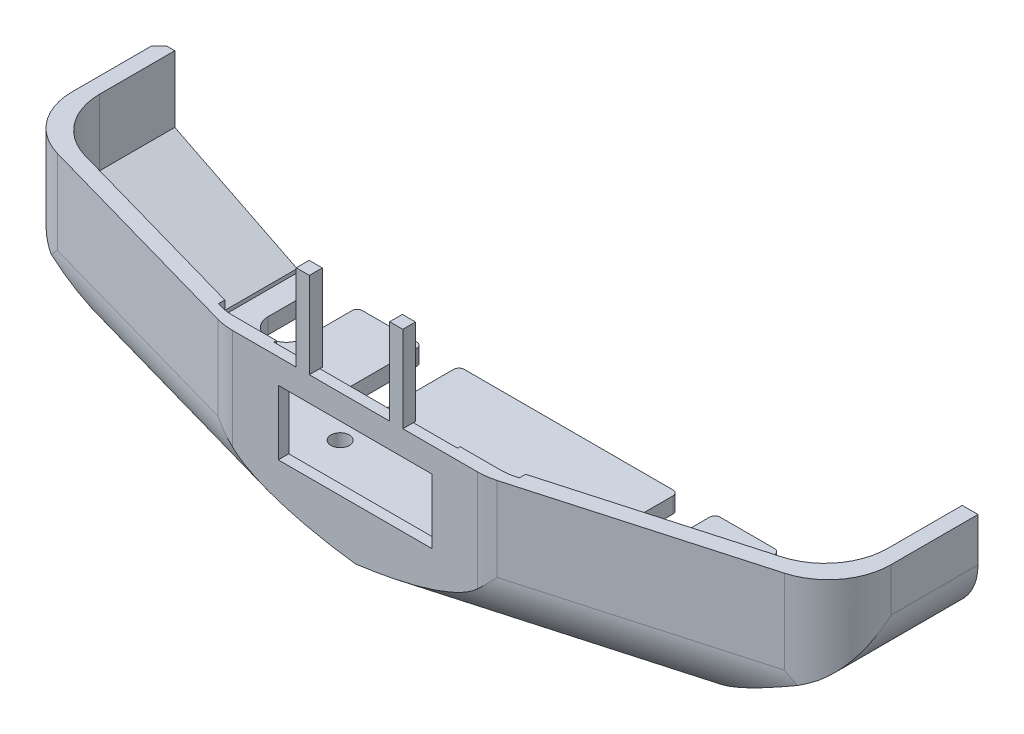
from build123d import *

# Parameters (mm, degrees)
BOSS_EXTRUDE1_DEPTH      = 30
BOSS_EXTRUDE1_DEPTH_BACK = 10.64
CUT_EXTRUDE1_DEPTH       = 89.136258146
SHELL1_T                 = -3
CUT_EXTRUDE4_DEPTH       = 4
CUT_EXTRUDE4_DEPTH_BACK  = 10
FILLET3_R                = 8
FILLET1_R                = 12
SKETCH4_R                = 1.75
CUT_EXTRUDE2_DEPTH       = 30
BOSS_EXTRUDE5_REACH      = 89.23
CUT_EXTRUDE5_DEPTH       = 4
SKETCH12_W               = 29.3
SKETCH12_H               = 12.3
CUT_EXTRUDE6_DEPTH       = 3
CUT_EXTRUDE7_DEPTH       = 22
FILLET2_START            = -12
FILLET2_DEPTH            = 29.471357663
BOSS_EXTRUDE4_REACH      = 98.884
SKETCH14_W               = 2.5
SKETCH14_H               = 16.4
SKETCH18_R               = 3.5
CUT_EXTRUDE11_DEPTH      = 10
CUT_EXTRUDE12_DEPTH      = 10
CHAMFER1_SIZE            = 1.5
FILLET5_R                = 1


with BuildPart() as part:
    # Sketch1 → Boss-Extrude1 (new, two sides: drawn at the far end of the back side and taken through both)
    with BuildSketch(Plane.XY.offset(-BOSS_EXTRUDE1_DEPTH_BACK)):
        Polygon((-51, -40.630628171), (51, -40.630628171), (78, -27.130628171), (78, -12.630628171), (-78, -12.630628171), (-78, -27.130628171), align=None)
    extrude(amount=BOSS_EXTRUDE1_DEPTH + BOSS_EXTRUDE1_DEPTH_BACK)

    # Sketch2 → Cut-Extrude1 (cut, through all)
    with BuildSketch(Plane(origin=(0, -12.630628171, 0), x_dir=(1, 0, 0), z_dir=(0, 1, 0))):
        Polygon((-78, -15), (-25, -30), (25, -30), (78, -15), (78, -44.649515781), (-78, -44.649515781), align=None)
    extrude(amount=-CUT_EXTRUDE1_DEPTH, mode=Mode.SUBTRACT)

    # Shell1
    shell1_openings = [part.faces().sort_by_distance(p)[0] for p in [
        (0, -25.765697486, -10.64),
    ]]
    offset(amount=SHELL1_T, openings=shell1_openings, kind=Kind.INTERSECTION)

    # Sketch7 → Cut-Extrude4 (cut, two sides: drawn at the far end of the back side and taken through both)
    with BuildSketch(Plane.XZ.offset(15.630628171).offset(-CUT_EXTRUDE4_DEPTH_BACK)):
        with BuildLine():
            Line((-24.583648517, 27), (24.096351483, 27))
            Line((24.096351483, 27), (66.26786959, 15.064664687))
            ThreePointArc((66.26786959, 15.064664687), (72.571165945, 10.756478016), (75, 3.518192137))
            Line((75, 3.518192137), (75, -10.64))
            Line((75, -10.64), (-75, -10.64))
            Line((-75, -10.64), (-75, 3.656106392))
            ThreePointArc((-75, 3.656106392), (-72.571165945, 10.894392271), (-66.26786959, 15.202578942))
            Line((-66.26786959, 15.202578942), (-24.583648517, 27))
        make_face()
    extrude(amount=CUT_EXTRUDE4_DEPTH + CUT_EXTRUDE4_DEPTH_BACK, mode=Mode.SUBTRACT)

    # Fillet3
    # the kernel refuses this fillet: 8 mm, written as the material it adds along each edge
    with BuildSketch(Plane(origin=(-69.535916984, -37.630628171, 14.277659868), x_dir=(0.27232246579934893, 0, -0.9622060458243663), z_dir=(0.9622060458243663, 0, 0.27232246579934893))) as fillet3_piece_1_section:
        with BuildLine():
            CenterArc((FILLET3_R, FILLET3_R), FILLET3_R, 180, 90)
            Line((0, FILLET3_R), (0, 0))
            Line((0, 0), (FILLET3_R, 0))
        make_face()
    fillet3_piece_1 = extrude(amount=80.717923528, mode=Mode.PRIVATE)
    fillet3_piece_1 = split(fillet3_piece_1, bisect_by=Plane(origin=(-65.687092801, -29.932979805, 14.277659868), z_dir=(0.44721359549995787, 0.894427190999916, 0)), keep=Keep.TOP, mode=Mode.PRIVATE)
    fillet3_piece_1 = split(fillet3_piece_1, bisect_by=Plane(origin=(-69.535916984, -37.630628171, 27), z_dir=(0, 0, -1)), keep=Keep.TOP, mode=Mode.PRIVATE)
    add(fillet3_piece_1)
    with BuildSketch(Plane(origin=(-8.131357041, -37.630628171, 36.258963837), x_dir=(-0.27232246579934893, 0, -0.9622060458243663), z_dir=(0.9622060458243663, 0, -0.27232246579934893))) as fillet3_piece_2_section:
        with BuildLine():
            CenterArc((FILLET3_R, FILLET3_R), FILLET3_R, 180, 90)
            Line((0, FILLET3_R), (0, 0))
            Line((0, 0), (FILLET3_R, 0))
        make_face()
    fillet3_piece_2 = extrude(amount=80.717923528, mode=Mode.PRIVATE)
    fillet3_piece_2 = split(fillet3_piece_2, bisect_by=Plane(origin=(3.553273581, -60.999889415, 36.258963837), z_dir=(-0.44721359549995787, 0.894427190999916, 0)), keep=Keep.TOP, mode=Mode.PRIVATE)
    fillet3_piece_2 = split(fillet3_piece_2, bisect_by=Plane(origin=(-8.131357041, -37.630628171, 27), z_dir=(0, 0, -1)), keep=Keep.TOP, mode=Mode.PRIVATE)
    add(fillet3_piece_2)

    # Fillet1
    # the kernel refuses this fillet: 12 mm, written as the material it takes off along each edge
    with BuildSketch(Plane(origin=(78, 10.057159045, 15), x_dir=(-0.9622060458243663, 0, 0.2723224657993491), z_dir=(0, -1, 0)), Plane(origin=(-78, 10.057159045, 15), x_dir=(0, 0, -1), z_dir=(0, -1, 0))) as fillet1_piece_1:
        with BuildLine():
            CenterArc((FILLET1_R * 0.756259573881, FILLET1_R), FILLET1_R, 195.802513954, 74.197486046)
            Line((-FILLET1_R * 0.205946471944, FILLET1_R * 0.727677534201), (0, 0))
            Line((0, 0), (FILLET1_R * 0.756259573881, 0))
        make_face()
    extrude(amount=59.875574433, mode=Mode.SUBTRACT)
    with BuildSketch(Plane(origin=(25, -8.46711334, 30), x_dir=(0.9622060458243658, 0, -0.27232246579935065), z_dir=(0, -1, 0))) as fillet1_piece_2:
        with BuildLine():
            CenterArc((FILLET1_R * 0.138783827712, -FILLET1_R), FILLET1_R, 90, 15.802513954)
            Line((-FILLET1_R * 0.133538638087, -FILLET1_R * 0.0377939541756), (0, 0))
            Line((0, 0), (FILLET1_R * 0.138783827712, 0))
        make_face()
    extrude(amount=36.327029663, mode=Mode.SUBTRACT)
    with BuildSketch(Plane(origin=(-24.072508337, -40.630628171, 43.888445756), x_dir=(0, 1, 0), z_dir=(0.9622060458243663, 0, -0.27232246579934893)), Plane(origin=(-79.866181375, -40.630628171, 14.47183546), x_dir=(0, 1, 0), z_dir=(0.9622060458243663, 0, 0.27232246579934893))) as fillet1_piece_3:
        with BuildLine():
            CenterArc((FILLET1_R, -FILLET1_R), FILLET1_R, 90, 90)
            Line((0, -FILLET1_R), (0, 0))
            Line((0, 0), (FILLET1_R, 0))
        make_face()
    extrude(amount=108.021239487, mode=Mode.SUBTRACT)
    with BuildSketch(Plane(origin=(-25, -8.46711334, 30), x_dir=(-0.9622060458243663, 0, -0.272322465799349), z_dir=(0, -1, 0))) as fillet1_piece_4:
        with BuildLine():
            CenterArc((FILLET1_R * 0.138783827712, FILLET1_R), FILLET1_R, 254.197486046, 15.802513954)
            Line((-FILLET1_R * 0.133538638087, FILLET1_R * 0.0377939541756), (0, 0))
            Line((0, 0), (FILLET1_R * 0.138783827712, 0))
        make_face()
    extrude(amount=36.327029663, mode=Mode.SUBTRACT)

    # Sketch4 → Cut-Extrude2 (cut)
    with BuildSketch(Plane(origin=(0, -37.630628171, 0), x_dir=(1, 0, 0), z_dir=(0, 1, 0))):
        with Locations(Location((-20, -12.86, 0), (0, 0, 270))):
            Circle(SKETCH4_R)
        with Locations(Location((20, -12.86, 0), (0, 0, 270))):
            Circle(SKETCH4_R)
    extrude(amount=-CUT_EXTRUDE2_DEPTH, mode=Mode.SUBTRACT)

    # Sketch10 → Boss-Extrude5 (add, up to next)
    with BuildSketch(Plane(origin=(0, -15.630628171, 0), x_dir=(1, 0, 0), z_dir=(0, 1, 0)), mode=Mode.PRIVATE) as boss_extrude5_sk1:
        with BuildLine():
            Line((75, -3.518192137), (75, -12.593307024))
            Line((75, -12.593307024), (66.26786959, -15.064664687))
            ThreePointArc((66.26786959, -15.064664687), (72.571165945, -10.756478016), (75, -3.518192137))
        make_face()
    boss_extrude5_tool1 = extrude(boss_extrude5_sk1.sketch, amount=-BOSS_EXTRUDE5_REACH, mode=Mode.PRIVATE) - part.part
    # Sketch10 → Boss-Extrude5 (add, up to next)
    with BuildSketch(Plane(origin=(0, -15.630628171, 0), x_dir=(1, 0, 0), z_dir=(0, 1, 0)), mode=Mode.PRIVATE) as boss_extrude5_sk2:
        with BuildLine():
            Line((-75.487297034, -12.593307024), (-69.584469585, -13.688292608))
            ThreePointArc((-69.584469585, -13.688292608), (-73.559678854, -9.356385551), (-75, -3.656106392))
            Line((-75, -3.656106392), (-75.487297034, -12.593307024))
        make_face()
    boss_extrude5_tool2 = extrude(boss_extrude5_sk2.sketch, amount=-BOSS_EXTRUDE5_REACH, mode=Mode.PRIVATE) - part.part
    add(boss_extrude5_tool1.solids().sort_by_distance((73.119365, -15.630628, 11.171058))[0])
    add(boss_extrude5_tool2.solids().sort_by_distance((-73.752935, -15.630628, 10.714464))[0])

    # Sketch11 → Cut-Extrude5 (cut)
    with BuildSketch(Plane(origin=(0, -12.630628171, 0), x_dir=(1, 0, 0), z_dir=(0, 1, 0))):
        with BuildLine():
            Line((-24.583648517, -27), (24.096351483, -27))
            Line((24.096351483, -27), (28.286429465, -25.814128873))
            Line((28.286429465, -25.814128873), (28.286429465, -27))
            ThreePointArc((28.286429465, -27), (26.816277128, -27.374133532), (25.30449625, -27.5))
            Line((25.30449625, -27.5), (24.30449625, -27.5))
            Line((24.30449625, -27.5), (-24.34, -27.5))
            Line((-24.34, -27.5), (-26.144116779, -27.495743925))
            ThreePointArc((-26.144116779, -27.495743925), (-27.651353583, -27.323810768), (-29.109406457, -26.904996238))
            Line((-29.109406457, -26.904996238), (-29.109406457, -25.719125111))
            Line((-29.109406457, -25.719125111), (-24.583648517, -27))
        make_face()
    extrude(amount=-CUT_EXTRUDE5_DEPTH, mode=Mode.SUBTRACT)

    # Sketch12 → Cut-Extrude6 (cut)
    with BuildSketch(Plane(origin=(0, 0, 27), x_dir=(-1, 0, 0), z_dir=(0, 0, -1))):
        with Locations((0, -23.480628171)):
            Rectangle(SKETCH12_W, SKETCH12_H)
    extrude(amount=-CUT_EXTRUDE6_DEPTH, mode=Mode.SUBTRACT)

    # Sketch13 → Cut-Extrude7 (cut)
    with BuildSketch(Plane(origin=(0, -12.630628171, 0), x_dir=(1, 0, 0), z_dir=(0, 1, 0))):
        Polygon((0, -28), (17.5, -28), (17.5, -24), (-17.5, -24), (-17.5, -28), align=None)
    extrude(amount=-CUT_EXTRUDE7_DEPTH, mode=Mode.SUBTRACT)

    # Fillet2: read off the stored shape, not the designer's step
    # Fillet2 outline → Fillet2 (cut)
    with BuildSketch(Plane.XY.offset(FILLET2_START)):
        with BuildLine():
            ThreePointArc((78, -20.950288284), (76.506508084, -26.207599405), (72.472135955, -29.894560194))
            Line((72.472135955, -29.894560194), (78, -27.130628171))
            Line((78, -27.130628171), (78, -20.950288284))
        make_face()
        with BuildLine():
            ThreePointArc((53.11145618, -39.574900081), (50.936849431, -40.363118066), (48.639320225, -40.630628171))
            Line((48.639320225, -40.630628171), (51, -40.630628171))
            Line((51, -40.630628171), (53.11145618, -39.574900081))
        make_face()
        with BuildLine():
            ThreePointArc((-48.639320225, -40.630628171), (-50.936849431, -40.363118066), (-53.11145618, -39.574900081))
            Line((-53.11145618, -39.574900081), (-51, -40.630628171))
            Line((-51, -40.630628171), (-48.639320225, -40.630628171))
        make_face()
        with BuildLine():
            ThreePointArc((-72.472135955, -29.894560194), (-76.506508084, -26.207599405), (-78, -20.950288284))
            Line((-78, -20.950288284), (-78, -27.130628171))
            Line((-78, -27.130628171), (-72.472135955, -29.894560194))
        make_face()
    extrude(amount=FILLET2_DEPTH, mode=Mode.SUBTRACT)

    # Boss-Extrude4: up to this plane
    boss_extrude4_end = Plane(origin=(-24.34, -16.630628171, 27.5), z_dir=(-0.0023590840693536327, 0, 0.9999972173573053))
    # Sketch14 → Boss-Extrude4 (add, up to the surface)
    with BuildSketch(Plane.XY.offset(30), mode=Mode.PRIVATE) as boss_extrude4_sk1:
        with Locations((-9.98, -4.430628171)):
            Rectangle(SKETCH14_W, SKETCH14_H)
    boss_extrude4_tool1 = split(extrude(boss_extrude4_sk1.sketch, amount=-BOSS_EXTRUDE4_REACH, mode=Mode.PRIVATE), bisect_by=boss_extrude4_end, keep=Keep.BOTH, mode=Mode.PRIVATE)
    add(boss_extrude4_tool1.solids().sort_by_distance((-9.98, -4.430628, 30))[0])
    # Sketch14 → Boss-Extrude4 (add, up to the surface)
    with BuildSketch(Plane.XY.offset(30), mode=Mode.PRIVATE) as boss_extrude4_sk2:
        with Locations((7.82, -4.430628171)):
            Rectangle(SKETCH14_W, SKETCH14_H)
    boss_extrude4_tool2 = split(extrude(boss_extrude4_sk2.sketch, amount=-BOSS_EXTRUDE4_REACH, mode=Mode.PRIVATE), bisect_by=boss_extrude4_end, keep=Keep.BOTH, mode=Mode.PRIVATE)
    add(boss_extrude4_tool2.solids().sort_by_distance((7.82, -4.430628, 30))[0])

    # Sketch18 → Cut-Extrude11 (cut)
    with BuildSketch(Plane.XZ.offset(40.630628171)):
        with BuildLine():
            ThreePointArc((-20.88, 3.86), (-24.38, 0.36), (-27.88, 3.86))
            Line((-27.88, 3.86), (-27.88, -10.64))
            Line((-27.88, -10.64), (-20.88, -10.64))
            Line((-20.88, -10.64), (-20.88, 3.86))
        make_face()
        with Locations((-24.38, 3.86)):
            Circle(SKETCH18_R)
        with Locations((-43.75, -0.64)):
            Circle(SKETCH18_R)
        with BuildLine():
            Line((-47.25, -10.64), (-40.25, -10.64))
            Line((-40.25, -10.64), (-40.25, -0.64))
            ThreePointArc((-40.25, -0.64), (-43.75, -4.14), (-47.25, -0.64))
            Line((-47.25, -0.64), (-47.25, -10.64))
        make_face()
        with BuildLine():
            Line((20.88, 3.86), (20.88, -10.64))
            Line((20.88, -10.64), (27.88, -10.64))
            Line((27.88, -10.64), (27.88, 3.86))
            ThreePointArc((27.88, 3.86), (24.38, 0.36), (20.88, 3.86))
        make_face()
        with Locations((24.38, 3.86)):
            Circle(SKETCH18_R)
        with BuildLine():
            Line((40.25, -0.64), (40.25, -10.64))
            Line((40.25, -10.64), (47.25, -10.64))
            Line((47.25, -10.64), (47.25, -0.64))
            ThreePointArc((47.25, -0.64), (43.75, -4.14), (40.25, -0.64))
        make_face()
        with Locations((43.75, -0.64)):
            Circle(SKETCH18_R)
    extrude(amount=-CUT_EXTRUDE11_DEPTH, mode=Mode.SUBTRACT)

    # Sketch19 → Cut-Extrude12 (cut)
    with BuildSketch(Plane(origin=(0, -37.630628171, 0), x_dir=(1, 0, 0), z_dir=(0, 1, 0))):
        Polygon((51.69958099, -7.397734366), (51.69958099, 10.64), (-51.69958099, 10.64), (-51.69958099, -7.397734366), (-32.5, -21.897192277), (32.5, -21.897192277), align=None)
    extrude(amount=CUT_EXTRUDE12_DEPTH, mode=Mode.SUBTRACT)

    # Chamfer1
    chamfer1_edges = [part.edges().sort_by_distance(p)[0] for p in [
        (-78, -16.790458228, -10.64),
        (-62.791796068, -34.734730138, -10.64),
        (-47.944660113, -40.630628171, -10.64),
        (-50.936849431, -40.363118066, -10.64),
        (-76.506508084, -26.207599405, -10.64),
    ]]
    chamfer(chamfer1_edges, length=CHAMFER1_SIZE)

    # Fillet5
    fillet5_edges = [part.edges().sort_by_distance(p)[0] for p in [
        (47.25, -39.130628171, -10.64),
        (40.25, -39.130628171, -10.64),
        (27.88, -39.130628171, -10.64),
        (20.88, -39.130628171, -10.64),
        (-40.25, -39.130628171, -10.64),
        (-47.25, -38.380628171, -10.64),
        (-20.88, -39.130628171, -10.64),
        (-27.88, -39.130628171, -10.64),
    ]]
    fillet(fillet5_edges, radius=FILLET5_R)


solid = part.part
